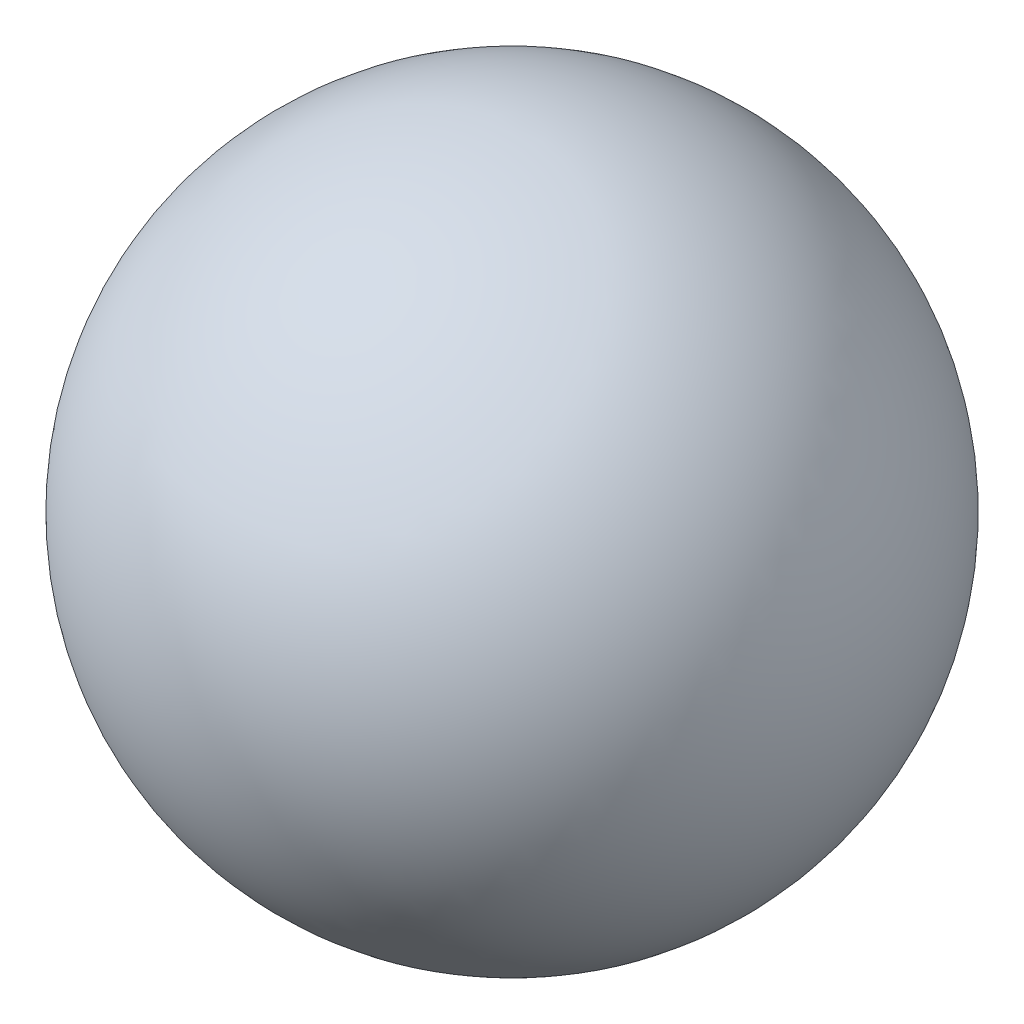
from build123d import *


with BuildPart() as part:
    # Sketch1 → Revolve1 (revolve)
    with BuildSketch(Plane.XY):
        with BuildLine():
            Line((0, -15), (0, 0))
            Line((0, 0), (0, 15))
            ThreePointArc((0, 15), (-15, 0), (0, -15))
        make_face()
    revolve(axis=Axis((0, 15, 0), (0, -1, 0)))


solid = part.part
